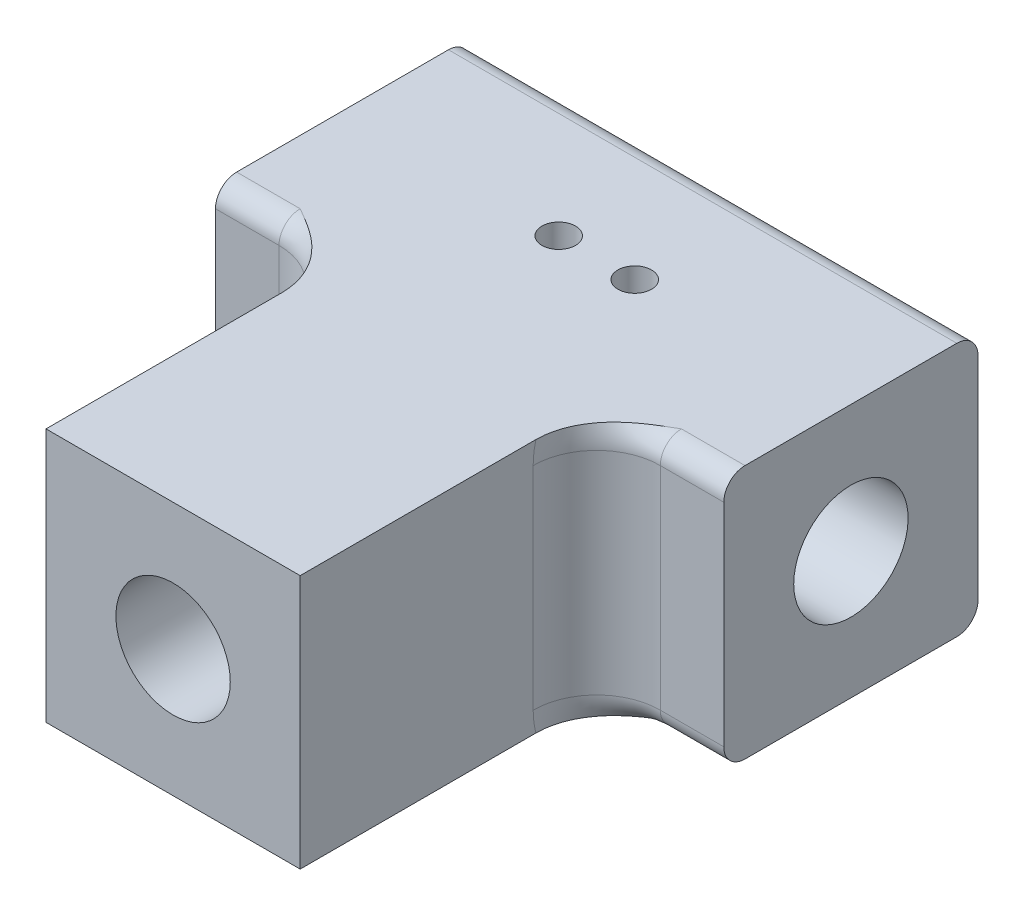
from build123d import *

# Parameters (mm, degrees)
SKETCH1_W                       = 12
SKETCH1_H                       = 6
BOSS_EXTRUDE1_DEPTH             = 6
F_1_32_0_03125_DIAMETER_HOLE1_D = 0.79375
SKETCH15_W                      = 6
SKETCH15_H                      = 6
BOSS_EXTRUDE2_DEPTH             = 7
FILLET4_R                       = 0.5
FILLET3_R                       = 1.5
SKETCH19_R                      = 1.35
CUT_EXTRUDE1_DEPTH              = 5.5
SKETCH16_R                      = 1.35
CUT_EXTRUDE2_DEPTH              = 5


with BuildPart() as part:
    # Sketch1 → Boss-Extrude1 (new body)
    with BuildSketch(Plane(origin=(0, 0, 0), x_dir=(1, 0, 0), z_dir=(0, 1, 0))):
        Rectangle(SKETCH1_W, SKETCH1_H)
    extrude(amount=BOSS_EXTRUDE1_DEPTH)

    # 1/32 (0.03125) Diameter Hole1 (through all)
    with Locations(Plane(origin=(0, 6, 0), x_dir=(1, 0, 0), z_dir=(0, 1, 0))):
        with Locations((0.896875, 0), (-0.896875, 0)):
            Hole(F_1_32_0_03125_DIAMETER_HOLE1_D / 2)

    # Sketch15 → Boss-Extrude2 (add)
    with BuildSketch(Plane.XY.offset(3)):
        with Locations((0, 3)):
            Rectangle(SKETCH15_W, SKETCH15_H)
    extrude(amount=BOSS_EXTRUDE2_DEPTH)

    # Fillet4
    fillet4_edges = [part.edges().sort_by_distance(p)[0] for p in [
        (4.5, 6, 3),
        (4.5, 0, 3),
        (-4.5, 0, 3),
        (0, 0, -3),
        (0, 6, -3),
        (-4.5, 6, 3),
    ]]
    fillet(fillet4_edges, radius=FILLET4_R)

    # Fillet3
    fillet3_edges = [part.edges().sort_by_distance(p)[0] for p in [
        (-3, 3, 3),
        (-3, 0.146446609, 2.853553391),
        (-3, 5.853553391, 2.853553391),
    ]]
    fillet(fillet3_edges, radius=FILLET3_R)
    fillet3_2_edges = [part.edges().sort_by_distance(p)[0] for p in [
        (3, 5.853553391, 2.853553391),
        (3, 3, 3),
        (3, 0.146446609, 2.853553391),
    ]]
    fillet(fillet3_2_edges, radius=FILLET3_R)

    # Sketch19 → Cut-Extrude1 (cut)
    with BuildSketch(Plane.ZY.offset(6)):
        with Locations((0, 3)):
            Circle(SKETCH19_R)
    cut_extrude1 = extrude(amount=-CUT_EXTRUDE1_DEPTH, mode=Mode.SUBTRACT)

    # Sketch16 → Cut-Extrude2 (cut)
    with BuildSketch(Plane.XY.offset(10)):
        with Locations((0, 3)):
            Circle(SKETCH16_R)
    extrude(amount=-CUT_EXTRUDE2_DEPTH, mode=Mode.SUBTRACT)

    # Mirror2: Cut-Extrude1 across plane
    add(cut_extrude1.mirror(Plane(origin=(0, 0, 0), x_dir=(0, 0, 1), z_dir=(1, 0, 0))), mode=Mode.SUBTRACT)


solid = part.part
